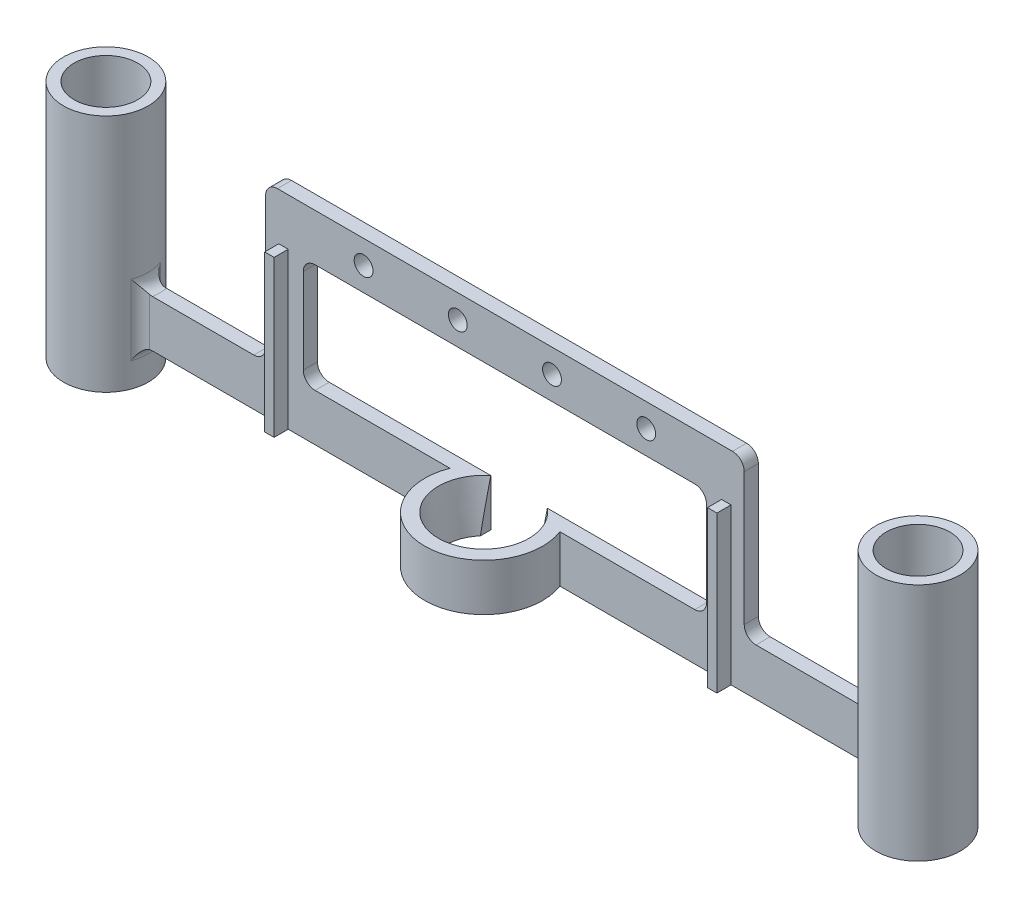
from build123d import *

# Parameters (mm, degrees)
BOSS_EXTRUDE1_DEPTH      = 38.1
BOSS_EXTRUDE1_DEPTH_BACK = 12.7
SKETCH1_R                = 9
SKETCH2_R                = 6.75
CUT_EXTRUDE1_DEPTH       = 50.8
BOSS_EXTRUDE2_DEPTH      = 1.5
BOSS_EXTRUDE2_DEPTH_BACK = 1.5
BOSS_EXTRUDE3_DEPTH      = 10
SKETCH9_W                = 12.009184536
SKETCH9_H                = 15.938825618
CUT_EXTRUDE2_DEPTH       = 3
SKETCH10_R               = 2
CUT_EXTRUDE3_DEPTH       = 3
SKETCH11_W               = 2
SKETCH11_H               = 33.1
BOSS_EXTRUDE4_DEPTH      = 3
FILLET1_R                = 2.5


with BuildPart() as part:
    # Sketch1 → Boss-Extrude1 (new, two sides: drawn at the far end of the back side and taken through both)
    with BuildSketch(Plane(origin=(0, 0, 0), x_dir=(1, 0, 0), z_dir=(0, 1, 0)).offset(-BOSS_EXTRUDE1_DEPTH_BACK)):
        with Locations(Location((86.2, 0, 0), (0, 0, 270))):
            Circle(SKETCH1_R)
    extrude(amount=BOSS_EXTRUDE1_DEPTH + BOSS_EXTRUDE1_DEPTH_BACK)

    # Sketch2 → Cut-Extrude1 (cut)
    with BuildSketch(Plane(origin=(0, -12.7, 0), x_dir=(-1, 0, 0), z_dir=(0, -1, 0))):
        with Locations(Location((-86.2, 0, 0), (0, 0, 90))):
            Circle(SKETCH2_R)
    extrude(amount=-CUT_EXTRUDE1_DEPTH, mode=Mode.SUBTRACT)

    # Sketch4 → Boss-Extrude2 (add, two sides: drawn at the far end of the back side and taken through both)
    with BuildSketch(Plane.XY.offset(-BOSS_EXTRUDE2_DEPTH_BACK)):
        Polygon((77.5, -5), (0, -5), (0, 5), (42.8, 5), (42.8, 28.1), (0, 28.1), (0, 38.1), (50.8, 38.1), (50.8, 28.1), (50.8, 5), (77.5, 5), align=None)
    extrude(amount=BOSS_EXTRUDE2_DEPTH + BOSS_EXTRUDE2_DEPTH_BACK)

    # Mirror2: part across plane


with BuildPart() as part_1:
    add(part.part)
    add(part.part.mirror(Plane(origin=(0, 38.1, -1.5), x_dir=(0, 0, 1), z_dir=(-1, 0, 0))))

    # Sketch6 → Boss-Extrude3 (add)
    with BuildSketch(Plane.XZ.offset(5)):
        with BuildLine():
            Line((10, -1.5), (-10, -1.5))
            ThreePointArc((-10, -1.5), (0, 18.5), (10, -1.5))
        make_face()
    extrude(amount=-BOSS_EXTRUDE3_DEPTH)

    # Cut-Loft1: read off the stored shape, not the designer's step
    # Cut-Loft1: loft between two sections, ruled curve by curve
    cut_loft1_from = [
        Edge.make_bspline([(-6.970459828, 5, 12.611945372), (-20.194350572, 5, -1.328974284), (-6.253430916, 5, -14.552865027), (6.970459828, 5, -0.611945372), (20.194350572, 5, 13.328974284), (6.253430916, 5, 26.552865027), (-6.970459828, 5, 12.611945372)], [0, 0, 0, 0, 0.5, 0.5, 0.5, 1, 1, 1, 1], 3, [1, 0.333333333, 0.333333333, 1, 0.333333333, 0.333333333, 1]),
    ]
    cut_loft1_to = [
        Edge.make_bspline([(-4.235564338, -5, 12.786751413), (-17.809067164, -5, 4.315622738), (-9.337938488, -5, -9.257880088), (4.235564338, -5, -0.786751413), (17.809067164, -5, 7.684377262), (9.337938488, -5, 21.257880088), (-4.235564338, -5, 12.786751413)], [0, 0, 0, 0, 0.5, 0.5, 0.5, 1, 1, 1, 1], 3, [1, 0.333333333, 0.333333333, 1, 0.333333333, 0.333333333, 1]),
    ]
    cut_loft1 = Solid(Shell([*[Face.make_surface_from_curves(cut_loft1_from[k], cut_loft1_to[k]) for k in range(1)], Face(Wire(cut_loft1_from)), Face(Wire(cut_loft1_to))]))
    add(cut_loft1, mode=Mode.SUBTRACT)

    # Sketch9 → Cut-Extrude2 (cut)
    with BuildSketch(Plane(origin=(0, 0, -1.5), x_dir=(-1, 0, 0), z_dir=(0, 0, -1))):
        with Locations((-2.92e-07, -2.969412809)):
            Rectangle(SKETCH9_W, SKETCH9_H)
    extrude(amount=-CUT_EXTRUDE2_DEPTH, mode=Mode.SUBTRACT)

    # Sketch10 → Cut-Extrude3 (cut)
    with BuildSketch(Plane.XY.offset(1.5)):
        with Locations((-30, 33.1)):
            Circle(SKETCH10_R)
        with Locations((-10, 33.1)):
            Circle(SKETCH10_R)
        with Locations((10, 33.1)):
            Circle(SKETCH10_R)
        with Locations((30, 33.1)):
            Circle(SKETCH10_R)
    extrude(amount=-CUT_EXTRUDE3_DEPTH, mode=Mode.SUBTRACT)

    # Sketch11 → Boss-Extrude4 (add)
    with BuildSketch(Plane.XY.offset(1.5)):
        with Locations((-47, 11.55)):
            Rectangle(SKETCH11_W, SKETCH11_H)
        with Locations((47, 11.55)):
            Rectangle(SKETCH11_W, SKETCH11_H)
    extrude(amount=BOSS_EXTRUDE4_DEPTH)

    # Fillet1
    fillet1_edges = [part_1.edges().sort_by_distance(p)[0] for p in [
        (50.8, 5, 0),
        (-50.8, 5, 0),
        (-42.8, 5, 0),
        (-42.8, 28.1, 0),
        (42.8, 5, 0),
        (42.8, 28.1, 0),
        (-77.325880325, 0, -1.5),
        (-77.325880325, 0, 1.5),
        (-77.2, -5, 0),
        (-77.2, 5, 0),
        (77.325880325, 0, -1.5),
        (77.2, -5, 0),
        (77.325880325, 0, 1.5),
        (77.2, 5, 0),
        (50.8, 38.1, 0),
        (-50.8, 38.1, 0),
    ]]
    fillet(fillet1_edges, radius=FILLET1_R)


solid = part_1.part
